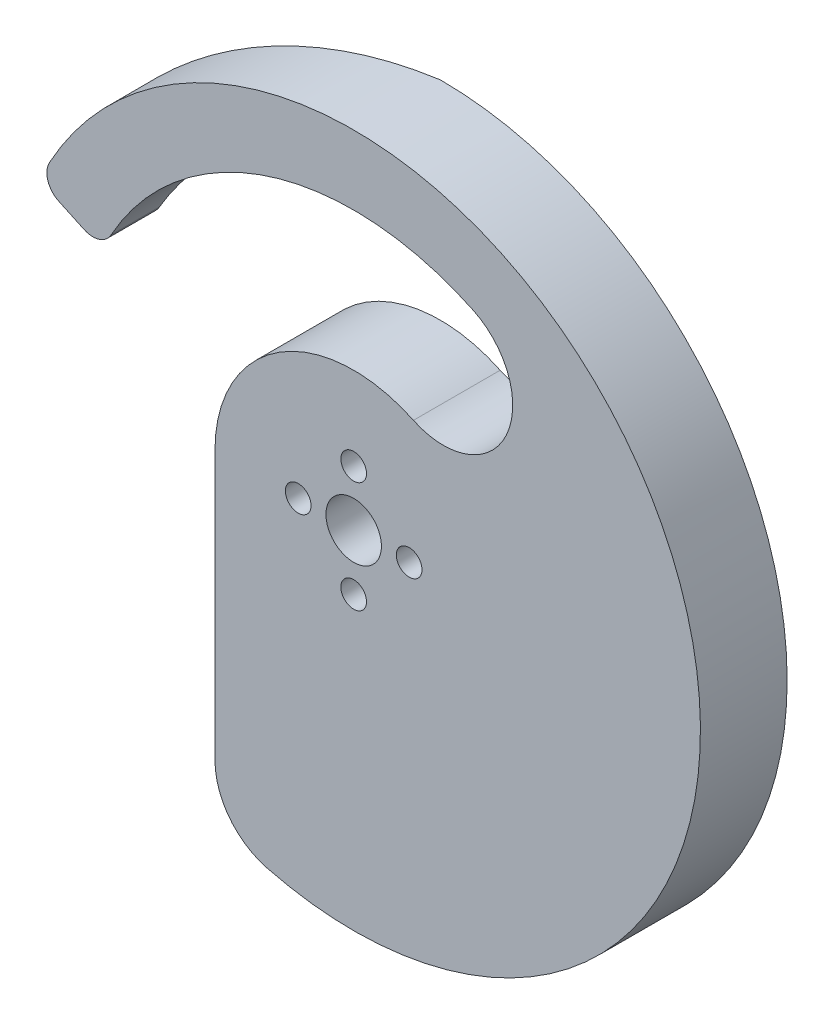
from build123d import *

# Parameters (mm, degrees)
SKETCH1_R           = 4
SKETCH1_R_2         = 1.85
BOSS_EXTRUDE1_DEPTH = 12.5
FILLET1_R           = 10
FILLET2_R           = 3
FILLET3_R           = 10
CUT_EXTRUDE1_DEPTH  = 20


with BuildPart() as part:
    # Sketch1 → Boss-Extrude1 (new body)
    with BuildSketch(Plane.XY):
        with BuildLine():
            Line((14.142135624, 14.142135624), (28.284271247, 28.284271247))
            ThreePointArc((28.284271247, 28.284271247), (-6.945927107, 39.39231012), (-36.252311481, 16.90473047))
            Line((-36.252311481, 16.90473047), (-45.315389352, 21.130913087))
            ThreePointArc((-45.315389352, 21.130913087), (46.768835106, 17.682648638), (-20, -45.82575695))
            Line((-20, -45.82575695), (-20, 0))
            ThreePointArc((-20, 0), (-7.653668647, 18.47759065), (14.142135624, 14.142135624))
        make_face()
        Circle(SKETCH1_R, mode=Mode.SUBTRACT)
        with Locations((0, 8)):
            Circle(SKETCH1_R_2, mode=Mode.SUBTRACT)
        with Locations((8, 0)):
            Circle(SKETCH1_R_2, mode=Mode.SUBTRACT)
        with Locations((0, -8)):
            Circle(SKETCH1_R_2, mode=Mode.SUBTRACT)
        with Locations((-8, 0)):
            Circle(SKETCH1_R_2, mode=Mode.SUBTRACT)
    extrude(amount=BOSS_EXTRUDE1_DEPTH)

    # Fillet1
    fillet1_edges = [part.edges().sort_by_distance(p)[0] for p in [
        (28.284271247, 28.284271247, 6.25),
        (14.142135624, 14.142135624, 6.25),
    ]]
    fillet(fillet1_edges, radius=FILLET1_R - 0.0001)  # a hair under: the kernel refuses the full size

    # Fillet2
    fillet2_edges = [part.edges().sort_by_distance(p)[0] for p in [
        (-36.252311481, 16.90473047, 6.25),
        (-45.315389352, 21.130913087, 6.25),
    ]]
    fillet(fillet2_edges, radius=FILLET2_R)

    # Fillet3
    fillet3_edges = [part.edges().sort_by_distance(p)[0] for p in [
        (-20, -45.82575695, 6.25),
    ]]
    fillet(fillet3_edges, radius=FILLET3_R)

    # Sketch3 → Cut-Extrude1 (cut)
    with BuildSketch(Plane(origin=(0, 0, 0), x_dir=(0, -1, 0), z_dir=(-0.1564344650402244, 0, -0.9876883405951388))):
        Polygon((-59.412445721, 3.059679317), (-37.456599692, -8.541700414), (-10.399971435, 42.663516366), (-32.355817465, 54.264896097), align=None)
    extrude(amount=CUT_EXTRUDE1_DEPTH, mode=Mode.SUBTRACT)


solid = part.part
